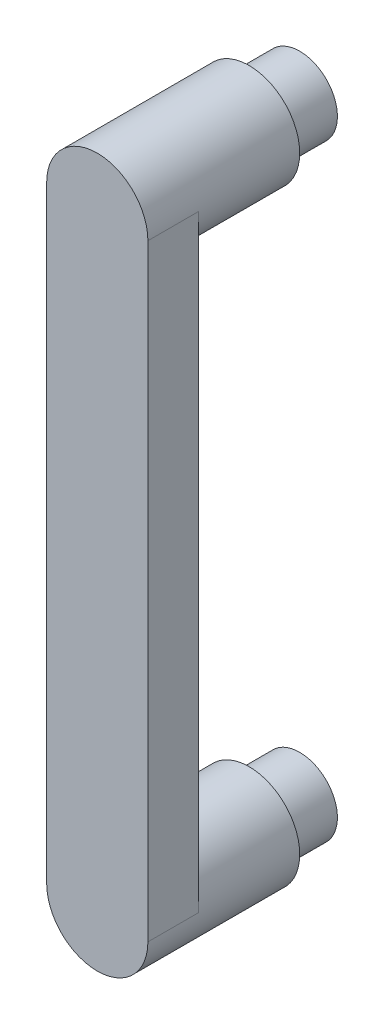
from build123d import *

# Parameters (mm, degrees)
SKETCH_1_R                       = 1.49
EXTRUDE_1_DEPTH                  = 4
SKETCH_2_R                       = 2
EXTRUDE_2_DEPTH                  = 4
EXTRUDE_START                    = 4
SKETCH_3_R                       = 2
EXTRUDE_3_DEPTH                  = 4
SKETCH_4_W                       = 4
SKETCH_4_H                       = 2
EXTRUDE_4_DEPTH                  = 12
EXTRUDE_4_DIRECTION_2_REACH      = 10.485
EXTRUDE_4_DIRECTION_2_END_RADIUS = 2
SKETCH_6_W                       = 4
SKETCH_6_H                       = 2
EXTRUDE_5_DEPTH                  = 12
EXTRUDE_5_DIRECTION_2_REACH      = 16.56
EXTRUDE_5_DIRECTION_2_END_RADIUS = 2
CUT_EXTRUDE_1_DEPTH              = 12
CUT_EXTRUDE_1_DEPTH_BACK         = 12
SKETCH_7_W                       = 8
SKETCH_7_H                       = 28
SKETCH_8_R                       = 1.025
CUT_EXTRUDE_2_DEPTH              = 2


with BuildPart() as part:
    # 草图1 → 凸台-拉伸1 (new body)
    with BuildSketch(Plane.XY):
        Circle(SKETCH_1_R)
    extrude(amount=EXTRUDE_1_DEPTH)

    # 草图2 → 凸台-拉伸2 (add)
    with BuildSketch(Plane(origin=(0, 0, 0), x_dir=(-1, 0, 0), z_dir=(0, 0, -1))):
        Circle(SKETCH_2_R)
    extrude(amount=EXTRUDE_2_DEPTH)

    # 草图3 → 凸台-拉伸3 (add)
    with BuildSketch(Plane.XY.offset(4).offset(EXTRUDE_START)):
        Circle(SKETCH_3_R)
    extrude(amount=-EXTRUDE_3_DEPTH)

    # 草图4 → 凸台-拉伸4 (add)
    with BuildSketch(Plane(origin=(0, 0, 0), x_dir=(1, 0, 0), z_dir=(0, 1, 0))):
        with Locations((0, 5)):
            Rectangle(SKETCH_4_W, SKETCH_4_H)
    extrude(amount=EXTRUDE_4_DEPTH)

    # 凸台-拉伸4 direction 2: up to this cylinder (the profile starts inside it)
    extrude_4_direction_2_end = Plane(origin=(0, 0, -5), z_dir=(0, 0, 1)) * Cylinder(EXTRUDE_4_DIRECTION_2_END_RADIUS, 25.97, mode=Mode.PRIVATE)
    # 草图4 → 凸台-拉伸4 direction 2 (add, up to the surface)
    with BuildSketch(Plane(origin=(0, 0, 0), x_dir=(1, 0, 0), z_dir=(0, 1, 0)), mode=Mode.PRIVATE) as extrude_4_direction_2_sk1:
        with Locations((0, 5)):
            Rectangle(SKETCH_4_W, SKETCH_4_H)
    extrude_4_direction_2_tool1 = extrude(extrude_4_direction_2_sk1.sketch, amount=-EXTRUDE_4_DIRECTION_2_REACH, mode=Mode.PRIVATE) & extrude_4_direction_2_end
    add(extrude_4_direction_2_tool1.solids().sort_by_distance((0, 0, -5))[0])

    # 草图6 → 凸台-拉伸5 (add)
    with BuildSketch(Plane(origin=(0, 0, 0), x_dir=(1, 0, 0), z_dir=(0, 1, 0))):
        with Locations((0, -9)):
            Rectangle(SKETCH_6_W, SKETCH_6_H)
    extrude(amount=EXTRUDE_5_DEPTH)

    # 凸台-拉伸5 direction 2: up to this cylinder (the profile starts inside it)
    extrude_5_direction_2_end = Plane(origin=(0, 0, 9), z_dir=(0, 0, -1)) * Cylinder(EXTRUDE_5_DIRECTION_2_END_RADIUS, 38.12, mode=Mode.PRIVATE)
    # 草图6 → 凸台-拉伸5 direction 2 (add, up to the surface)
    with BuildSketch(Plane(origin=(0, 0, 0), x_dir=(1, 0, 0), z_dir=(0, 1, 0)), mode=Mode.PRIVATE) as extrude_5_direction_2_sk1:
        with Locations((0, -9)):
            Rectangle(SKETCH_6_W, SKETCH_6_H)
    extrude_5_direction_2_tool1 = extrude(extrude_5_direction_2_sk1.sketch, amount=-EXTRUDE_5_DIRECTION_2_REACH, mode=Mode.PRIVATE) & extrude_5_direction_2_end
    add(extrude_5_direction_2_tool1.solids().sort_by_distance((0, 0, 9))[0])

    # 镜向2: part across plane


with BuildPart() as part_1:
    add(part.part)
    add(part.part.mirror(Plane.ZX.offset(12)))

    # 草图7 → 切除-拉伸1 (cut, two sides: drawn at the far end of the back side and taken through both)
    with BuildSketch(Plane(origin=(0, 0, 0), x_dir=(0, 0, -1), z_dir=(1, 0, 0)).offset(-CUT_EXTRUDE_1_DEPTH_BACK)):
        with Locations((2, 12)):
            Rectangle(SKETCH_7_W, SKETCH_7_H)
    extrude(amount=CUT_EXTRUDE_1_DEPTH + CUT_EXTRUDE_1_DEPTH_BACK, mode=Mode.SUBTRACT)

    # 草图8 → 切除-拉伸2 (cut)
    with BuildSketch(Plane(origin=(0, 0, 2), x_dir=(-1, 0, 0), z_dir=(0, 0, -1))):
        with Locations((0, 24)):
            Circle(SKETCH_8_R)
        Circle(SKETCH_8_R)
    extrude(amount=-CUT_EXTRUDE_2_DEPTH, mode=Mode.SUBTRACT)


solid = part_1.part
